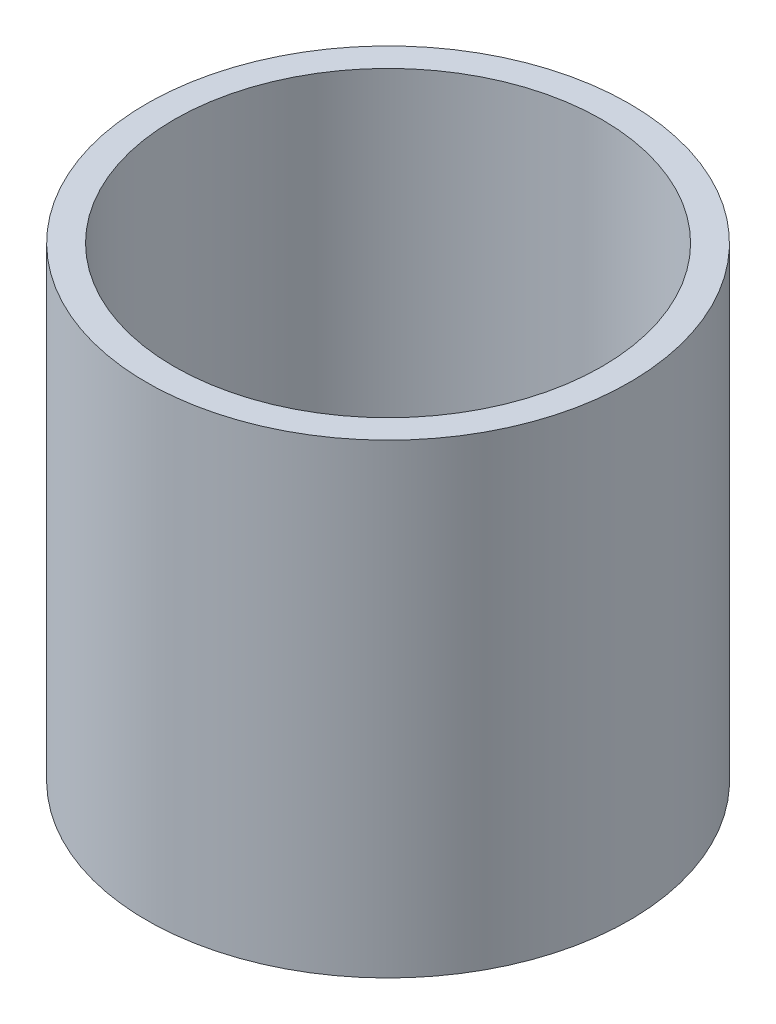
from build123d import *

# Parameters (mm, degrees)
SKETCH1_R           = 39.5
SKETCH1_R_2         = 35
BOSS_EXTRUDE1_DEPTH = 76.2


with BuildPart() as part:
    # Sketch1 → Boss-Extrude1 (new body)
    with BuildSketch(Plane(origin=(0, 0, 0), x_dir=(1, 0, 0), z_dir=(0, 1, 0))):
        Circle(SKETCH1_R)
        Circle(SKETCH1_R_2, mode=Mode.SUBTRACT)
    extrude(amount=BOSS_EXTRUDE1_DEPTH)


solid = part.part
